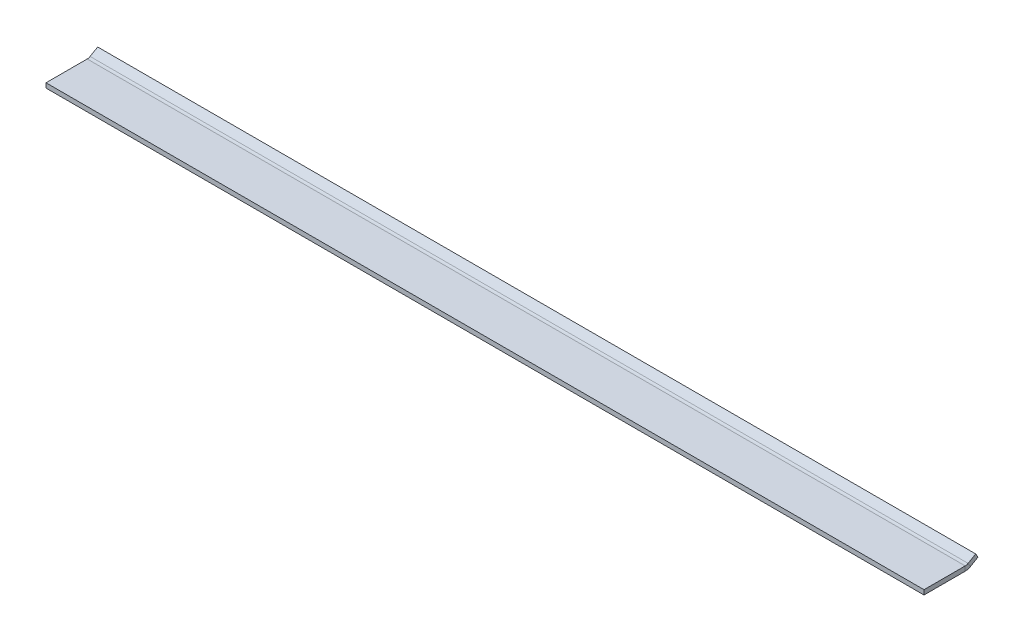
from build123d import *

# Parameters (mm, degrees)
SKETCH1_W            = 2280
SKETCH1_H            = 135
BASE_FLANGE1_DEPTH   = 12
EDGE_FLANGE1_START   = -1140
EDGE_FLANGE1_DEPTH   = 2280
EDGE_FLANGE1_2_DEPTH = 2280


# Read off the part's stored shape, not the designer's step: Edge-Flange1
# Sheet-metal steps are written as plain solids
with BuildPart() as part:
    # Sketch1 → Base-Flange1 (new body)
    with BuildSketch(Plane(origin=(0, 0, 0), x_dir=(1, 0, 0), z_dir=(0, 1, 0))):
        Rectangle(SKETCH1_W, SKETCH1_H)
    extrude(amount=-BASE_FLANGE1_DEPTH)

    # Edge-Flange1 outline → Edge-Flange1 (cut)
    with BuildSketch(Plane.YZ.offset(EDGE_FLANGE1_START)):
        with BuildLine():
            Line((0, -67.5), (-8.382685902, -52.980762114))
            ThreePointArc((-8.382685902, -52.980762114), (-11.07999731, -46.468876332), (-12, -39.480762114))
            Line((-12, -39.480762114), (-12, -67.5))
            Line((-12, -67.5), (0, -67.5))
        make_face()
    extrude(amount=EDGE_FLANGE1_DEPTH, mode=Mode.SUBTRACT)

    # Edge-Flange1 2 outline → Edge-Flange1 2 (add)
    with BuildSketch(Plane.YZ.offset(EDGE_FLANGE1_START)):
        with BuildLine():
            Line((0, -39.480762114), (0, -67.5))
            Line((0, -67.5), (3, -72.696152423))
            Line((3, -72.696152423), (13.392304845, -66.696152423))
            Line((13.392304845, -66.696152423), (2.009618943, -46.980762114))
            ThreePointArc((2.009618943, -46.980762114), (0.511112606, -43.36304779), (0, -39.480762114))
        make_face()
    extrude(amount=EDGE_FLANGE1_2_DEPTH)


solid = part.part
